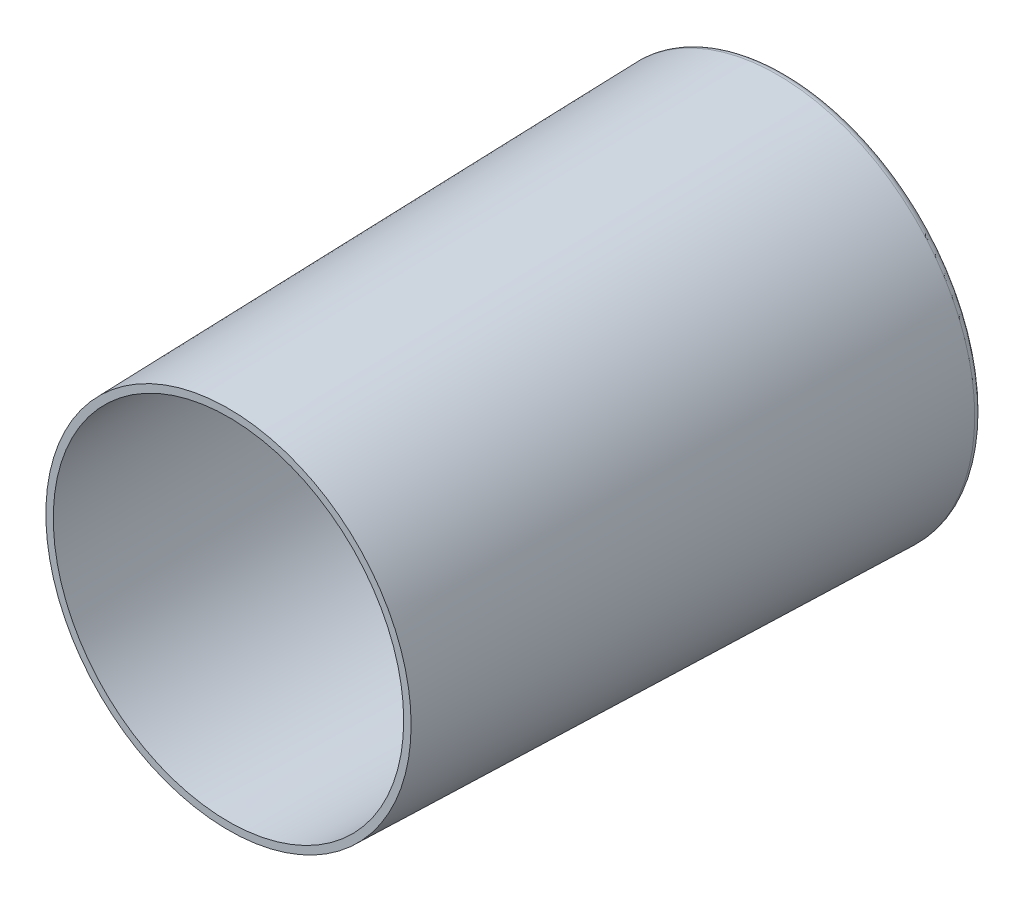
from build123d import *

# Parameters (mm, degrees)
SKETCH2_R                 = 49.983
MAIN_PART_DEPTH           = 30
MAIN_PART_TAPER           = 1.5
MAIN_PART_OTHER_WAY_DEPTH = 120
MAIN_PART_OTHER_WAY_TAPER = -1.5
SKETCH3_R                 = 47.197422353
MAINCUT_DEPTH             = 150
MAINCUT_DRAFT             = 1.5
FILLET1_R                 = 2


with BuildPart() as part:
    # Sketch2 → Main part (new body)
    with BuildSketch(Plane.XY):
        with Locations((-10.948, 38.989)):
            Circle(SKETCH2_R)
    extrude(amount=MAIN_PART_DEPTH, taper=MAIN_PART_TAPER)

    # Sketch2 → Main part other way (add)
    with BuildSketch(Plane.XY):
        with Locations((-10.948, 38.989)):
            Circle(SKETCH2_R)
    extrude(amount=-MAIN_PART_OTHER_WAY_DEPTH, taper=MAIN_PART_OTHER_WAY_TAPER)


with BuildPart() as maincut_tool:
    # Sketch3 → MainCut (with draft: the straight prism first)
    with BuildSketch(Plane.XY.offset(30)):
        with Locations((-10.948, 38.989)):
            Circle(SKETCH3_R)
    extrude(amount=-MAINCUT_DEPTH)
    # MainCut: the draft: its side faces are tilted about the plane it starts from
    maincut_sides = [maincut_tool.faces().sort_by_distance(p)[0] for p in [
        (-58.145422353, 38.989, -45),
    ]]
    draft(maincut_sides, Plane.XY.offset(30), MAINCUT_DRAFT)


with BuildPart() as part_1:
    add(part.part)

    # MainCut: cut by maincut_tool
    add(maincut_tool.part, mode=Mode.SUBTRACT)

    # Fillet1
    # the kernel refuses this fillet: 2 mm, written as the material it takes off along each edge
    with BuildSketch(Plane(origin=(-10.948, 38.989, -120), x_dir=(1, 0, 0), z_dir=(0, -1, 0))) as fillet1_piece_1:
        with BuildLine():
            CenterArc((53.125310588 - FILLET1_R * 1.02652871406, FILLET1_R), FILLET1_R, 270, 91.5)
            Line((53.125310588 - FILLET1_R * 1.02652871406, 0), (53.125310588, 0))
            Line((53.125310588, 0), (53.125310588 - FILLET1_R * 0.0268713890845, FILLET1_R * 1.02617694831))
        make_face()
    revolve(axis=Axis((-10.948, 38.989, -120), (0, 0, 1)), mode=Mode.SUBTRACT)


solid = part_1.part
